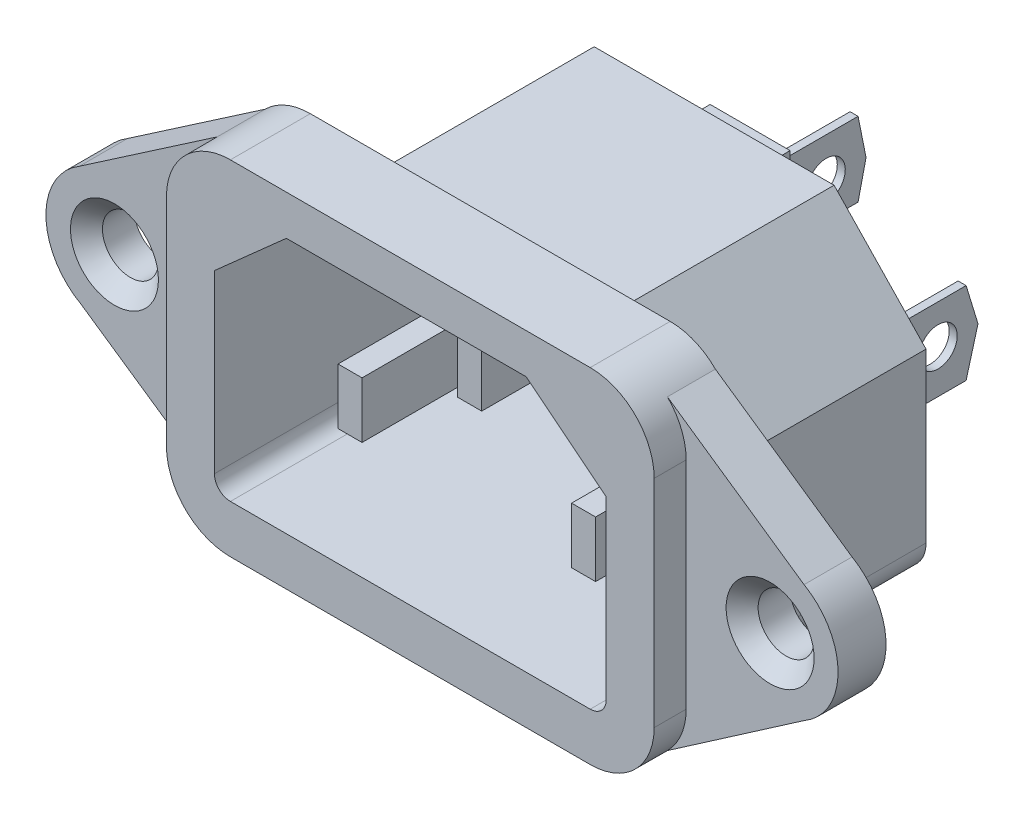
from build123d import *

# Parameters (mm, degrees)
SKETCH_1_R          = 1.75
EXTRUDE_1_DEPTH     = 3
EXTRUDE_START       = 2
EXTRUDE_2_DEPTH     = 2
EXTRUDE_3_DEPTH     = 14
CUT_EXTRUDE_START   = -1
CUT_EXTRUDE_1_DEPTH = 1
CHAMFER_1_SIZE      = 1
CHAMFER_2_SIZE      = 1
SKETCH_6_W          = 5
SKETCH_6_H          = 10
EXTRUDE_4_DEPTH     = 2
SKETCH_7_W          = 0.5
SKETCH_7_H          = 8
EXTRUDE_5_DEPTH     = 7
SKETCH_8_R          = 1.2
CUT_EXTRUDE_2_DEPTH = 3
SKETCH_11_R         = 1.2
CUT_EXTRUDE_3_DEPTH = 3
SKETCH_12_R         = 1.2
CUT_EXTRUDE_4_DEPTH = 3
CUT_EXTRUDE_6_DEPTH = 17
SKETCH_16_W         = 5
SKETCH_16_H         = 10
EXTRUDE_7_DEPTH     = 5
SKETCH_17_W         = 1.5
SKETCH_17_H         = 3.5
EXTRUDE_8_DEPTH     = 12.5


with BuildPart() as part:
    # Эскиз1 → Бобышка-Вытянуть1 (new body)
    with BuildSketch(Plane.XY):
        with BuildLine():
            ThreePointArc((20.928890361, -4.264902198), (23.055555556, -0.583333333), (20.928890361, 3.098235531))
            Line((20.928890361, 3.098235531), (12.38398268, 8.995093791))
            ThreePointArc((12.38398268, 8.995093791), (11.086289285, 9.862184797), (9.555555556, 10.166666667))
            Line((9.555555556, 10.166666667), (-12.944444444, 10.166666667))
            ThreePointArc((-12.944444444, 10.166666667), (-14.475178174, 9.862184797), (-15.772871569, 8.995093791))
            Line((-15.772871569, 8.995093791), (-24.387947706, 3.098235531))
            ThreePointArc((-24.387947706, 3.098235531), (-26.479451538, -0.647521096), (-24.276691296, -4.328951295))
            Line((-24.276691296, -4.328951295), (-15.772871569, -10.161760458))
            ThreePointArc((-15.772871569, -10.161760458), (-14.475178174, -11.028851463), (-12.944444444, -11.333333333))
            Line((-12.944444444, -11.333333333), (9.555555556, -11.333333333))
            ThreePointArc((9.555555556, -11.333333333), (11.086289285, -11.028851463), (12.38398268, -10.161760458))
            Line((12.38398268, -10.161760458), (20.928890361, -4.264902198))
        make_face()
        with Locations((18.805555556, -0.583333333)):
            Circle(SKETCH_1_R, mode=Mode.SUBTRACT)
        with BuildLine():
            ThreePointArc((-23.944444444, -0.583333333), (-22.194444444, 1.166666667), (-20.444444444, -0.583333333))
            ThreePointArc((-20.444444444, -0.583333333), (-22.194444444, -2.333333333), (-23.944444444, -0.583333333))
        make_face(mode=Mode.SUBTRACT)
    extrude(amount=-EXTRUDE_1_DEPTH)

    # Эскиз3 → Бобышка-Вытянуть2 (add)
    with BuildSketch(Plane.XY.offset(EXTRUDE_START)):
        with BuildLine():
            Line((-12.944444444, 10.166666667), (9.555555556, 10.166666667))
            ThreePointArc((9.555555556, 10.166666667), (12.38398268, 8.995093791), (13.555555556, 6.166666667))
            Line((13.555555556, 6.166666667), (13.555555556, -7.333333333))
            ThreePointArc((13.555555556, -7.333333333), (12.38398268, -10.161760458), (9.555555556, -11.333333333))
            Line((9.555555556, -11.333333333), (-12.944444444, -11.333333333))
            ThreePointArc((-12.944444444, -11.333333333), (-15.772871569, -10.161760458), (-16.944444444, -7.333333333))
            Line((-16.944444444, -7.333333333), (-16.944444444, 6.166666667))
            ThreePointArc((-16.944444444, 6.166666667), (-15.772871569, 8.995093791), (-12.944444444, 10.166666667))
        make_face()
    extrude(amount=-EXTRUDE_2_DEPTH)

    # Эскиз4 → Бобышка-Вытянуть3 (add)
    with BuildSketch(Plane(origin=(0, 0, -3), x_dir=(-1, 0, 0), z_dir=(0, 0, -1))):
        with BuildLine():
            Line((-5.805555556, 8.666666667), (9.194444444, 8.666666667))
            Line((9.194444444, 8.666666667), (14.979451538, 2.666666667))
            Line((14.979451538, 2.666666667), (14.979451538, -7.833333333))
            ThreePointArc((14.979451538, -7.833333333), (14.393665101, -9.247546896), (12.979451538, -9.833333333))
            Line((12.979451538, -9.833333333), (-9.555555556, -9.833333333))
            ThreePointArc((-9.555555556, -9.833333333), (-10.969769118, -9.247546896), (-11.555555556, -7.833333333))
            Line((-11.555555556, -7.833333333), (-11.555555556, 2.666666667))
            Line((-11.555555556, 2.666666667), (-5.805555556, 8.666666667))
        make_face()
    extrude(amount=EXTRUDE_3_DEPTH)

    # Эскиз5 → Вырез-Вытянуть1 (cut)
    with BuildSketch(Plane(origin=(0, 0, -3), x_dir=(-1, 0, 0), z_dir=(0, 0, -1)).offset(CUT_EXTRUDE_START)):
        with BuildLine():
            Line((-17.143050828, 3.367976899), (-10.046994094, 8.202368214))
            Line((-10.046994094, 8.202368214), (-8.140923226, 8.202368214))
            Line((-8.140923226, 8.202368214), (-13.112857934, 2.867546546))
            Line((-13.112857934, 2.867546546), (-13.112857934, -7.3554747))
            Line((-13.112857934, -7.3554747), (-17.143050828, -4.534643565))
            ThreePointArc((-17.143050828, -4.534643565), (-14.518741526, -0.583333333), (-17.143050828, 3.367976899))
        make_face()
        with BuildLine():
            Line((20.535362375, 3.367976899), (13.514232587, 8.202368214))
            Line((13.514232587, 8.202368214), (11.503497241, 8.202368214))
            Line((11.503497241, 8.202368214), (16.838318908, 2.867546546))
            Line((16.838318908, 2.867546546), (16.838318908, -7.028531022))
            Line((16.838318908, -7.028531022), (20.535362375, -4.534643565))
            ThreePointArc((20.535362375, -4.534643565), (17.908956624, -0.583333333), (20.535362375, 3.367976899))
        make_face()
    extrude(amount=CUT_EXTRUDE_1_DEPTH, mode=Mode.SUBTRACT)

    # Фаска1
    chamfer_1_edges = [part.edges().sort_by_distance(p)[0] for p in [
        (17.055555556, -0.583333333, 0),
    ]]
    chamfer(chamfer_1_edges, length=CHAMFER_1_SIZE)

    # Фаска2
    chamfer_2_edges = [part.edges().sort_by_distance(p)[0] for p in [
        (-23.944444444, -0.583333333, 0),
    ]]
    chamfer(chamfer_2_edges, length=CHAMFER_2_SIZE)

    # Эскиз6 → Бобышка-Вытянуть4 (add)
    with BuildSketch(Plane(origin=(0, 0, -17), x_dir=(-1, 0, 0), z_dir=(0, 0, -1))):
        with Locations((-5.555555556, -3.333333333)):
            Rectangle(SKETCH_6_W, SKETCH_6_H)
        with Locations((1.444444444, 2.166666667)):
            Rectangle(SKETCH_6_W, SKETCH_6_H)
        with Locations((8.979451538, -3.333333333)):
            Rectangle(SKETCH_6_W, SKETCH_6_H)
    extrude(amount=EXTRUDE_4_DEPTH)

    # Эскиз7 → Бобышка-Вытянуть5 (add, symmetric)
    with BuildSketch(Plane(origin=(0, 0, -19), x_dir=(-1, 0, 0), z_dir=(0, 0, -1))):
        with Locations((-5.555555556, -3.333333333)):
            Rectangle(SKETCH_7_W, SKETCH_7_H)
        with Locations((1.444444444, 2.166666667)):
            Rectangle(SKETCH_7_W, SKETCH_7_H)
        with Locations((8.979451538, -3.333333333)):
            Rectangle(SKETCH_7_W, SKETCH_7_H)
    extrude(amount=EXTRUDE_5_DEPTH, both=True)

    # Эскиз8 → Вырез-Вытянуть2 (cut)
    with BuildSketch(Plane.ZY.offset(9.229451538)):
        Polygon((-25.852859053, -5.08301967), (-26, -3.333333333), (-26, -7.333333333), (-19, -7.333333333), (-19, -7.048011738), (-20.028349255, -7.182352132), (-19.159176422, -5.468865668), (-20.281780656, -5.468865668), (-20.667626654, -5.08301967), align=None)
        Polygon((-26, 0.666666667), (-26, -3.333333333), (-25.852859053, -1.583646996), (-20.667626654, -1.583646996), (-20.281780656, -1.197800999), (-19.159176422, -1.197800999), (-20.028349255, 0.515685465), (-19, 0.381345072), (-19, 0.666666667), align=None)
        with Locations((-23.476723057, -3.333333333)):
            Circle(SKETCH_8_R)
    extrude(amount=-CUT_EXTRUDE_2_DEPTH, mode=Mode.SUBTRACT)

    # Эскиз11 → Вырез-Вытянуть3 (cut)
    with BuildSketch(Plane.ZY.offset(1.694444444)):
        with Locations((-23.5, 2.166666667)):
            Circle(SKETCH_11_R)
        Polygon((-19, -1.833333333), (-19, 0), (-25.500216553, 0), (-26, 2.166666667), (-26, -1.833333333), align=None)
        Polygon((-25.500216553, 4.64880104), (-19, 4.64880104), (-19, 6.166666667), (-26, 6.166666667), (-26, 2.166666667), align=None)
    extrude(amount=-CUT_EXTRUDE_3_DEPTH, mode=Mode.SUBTRACT)

    # Эскиз12 → Вырез-Вытянуть4 (cut)
    with BuildSketch(Plane.ZY.offset(-5.305555556)):
        with Locations((-23.5, -3.333333333)):
            Circle(SKETCH_12_R)
        Polygon((-19, -7.333333333), (-19, -6.035631996), (-25.256261819, -6.035631996), (-26, -3.333333333), (-26, -7.333333333), align=None)
        Polygon((-25.256261819, -0.896417806), (-19, -0.896417806), (-19, 0.666666667), (-26, 0.666666667), (-26, -3.333333333), align=None)
    extrude(amount=-CUT_EXTRUDE_4_DEPTH, mode=Mode.SUBTRACT)

    # Эскиз15 → Вырез-Вытянуть6 (cut)
    with BuildSketch(Plane.XY.offset(2)):
        with BuildLine():
            Line((-9.444444444, 7.666666667), (5.555555556, 7.666666667))
            Line((5.555555556, 7.666666667), (10.555555556, 3.666666667))
            Line((10.555555556, 3.666666667), (10.555555556, -7.333333333))
            ThreePointArc((10.555555556, -7.333333333), (10.262662337, -8.040440115), (9.555555556, -8.333333333))
            Line((9.555555556, -8.333333333), (-12.944444444, -8.333333333))
            ThreePointArc((-12.944444444, -8.333333333), (-13.651551226, -8.040440115), (-13.944444444, -7.333333333))
            Line((-13.944444444, -7.333333333), (-13.944444444, 3.666666667))
            Line((-13.944444444, 3.666666667), (-9.444444444, 7.666666667))
        make_face()
    extrude(amount=-CUT_EXTRUDE_6_DEPTH, mode=Mode.SUBTRACT)

    # Эскиз16 → Бобышка-Вытянуть7 (add)
    with BuildSketch(Plane(origin=(0, 0, -19), x_dir=(-1, 0, 0), z_dir=(0, 0, -1))):
        with Locations((8.979451538, -3.333333333)):
            Rectangle(SKETCH_16_W, SKETCH_16_H)
        with Locations((1.444444444, 2.166666667)):
            Rectangle(SKETCH_16_W, SKETCH_16_H)
        with Locations((-5.555555556, -3.333333333)):
            Rectangle(SKETCH_16_W, SKETCH_16_H)
    extrude(amount=-EXTRUDE_7_DEPTH)

    # Эскиз17 → Бобышка-Вытянуть8 (add)
    with BuildSketch(Plane.XY.offset(-14)):
        with Locations((-8.961393916, -2.773412546)):
            Rectangle(SKETCH_17_W, SKETCH_17_H)
        with Locations((-1.478668657, 2.665013022)):
            Rectangle(SKETCH_17_W, SKETCH_17_H)
        with Locations((5.641966267, -3.00690977)):
            Rectangle(SKETCH_17_W, SKETCH_17_H)
    extrude(amount=EXTRUDE_8_DEPTH)


solid = part.part
